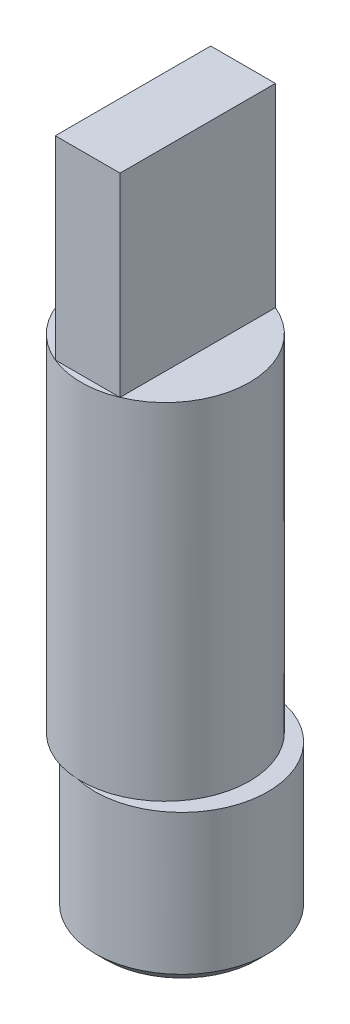
from build123d import *

# Parameters (mm, degrees)
SKETCH1_R           = 4
BOSS_EXTRUDE1_DEPTH = 7
SKETCH2_R           = 3.9
BOSS_EXTRUDE2_DEPTH = 16
CHAMFER1_SIZE       = 0.5
SKETCH3_W           = 3
SKETCH3_H           = 7.2
BOSS_EXTRUDE3_DEPTH = 9


with BuildPart() as part:
    # Sketch1 → Boss-Extrude1 (new body)
    with BuildSketch(Plane(origin=(0, 0, 0), x_dir=(1, 0, 0), z_dir=(0, 1, 0))):
        Circle(SKETCH1_R)
    extrude(amount=BOSS_EXTRUDE1_DEPTH)

    # Sketch2 → Boss-Extrude2 (add)
    with BuildSketch(Plane(origin=(0, 7, 0), x_dir=(1, 0, 0), z_dir=(0, 1, 0))):
        with Locations((-0.75, 0)):
            Circle(SKETCH2_R)
    extrude(amount=BOSS_EXTRUDE2_DEPTH)

    # Chamfer1
    chamfer1_edges = [part.edges().sort_by_distance(p)[0] for p in [
        (-4, 0, 0),
    ]]
    chamfer(chamfer1_edges, length=CHAMFER1_SIZE)

    # Sketch3 → Boss-Extrude3 (add)
    with BuildSketch(Plane(origin=(0, 23, 0), x_dir=(1, 0, 0), z_dir=(0, 1, 0))):
        with Locations((-0.75, 0)):
            Rectangle(SKETCH3_W, SKETCH3_H)
    extrude(amount=BOSS_EXTRUDE3_DEPTH)


solid = part.part
